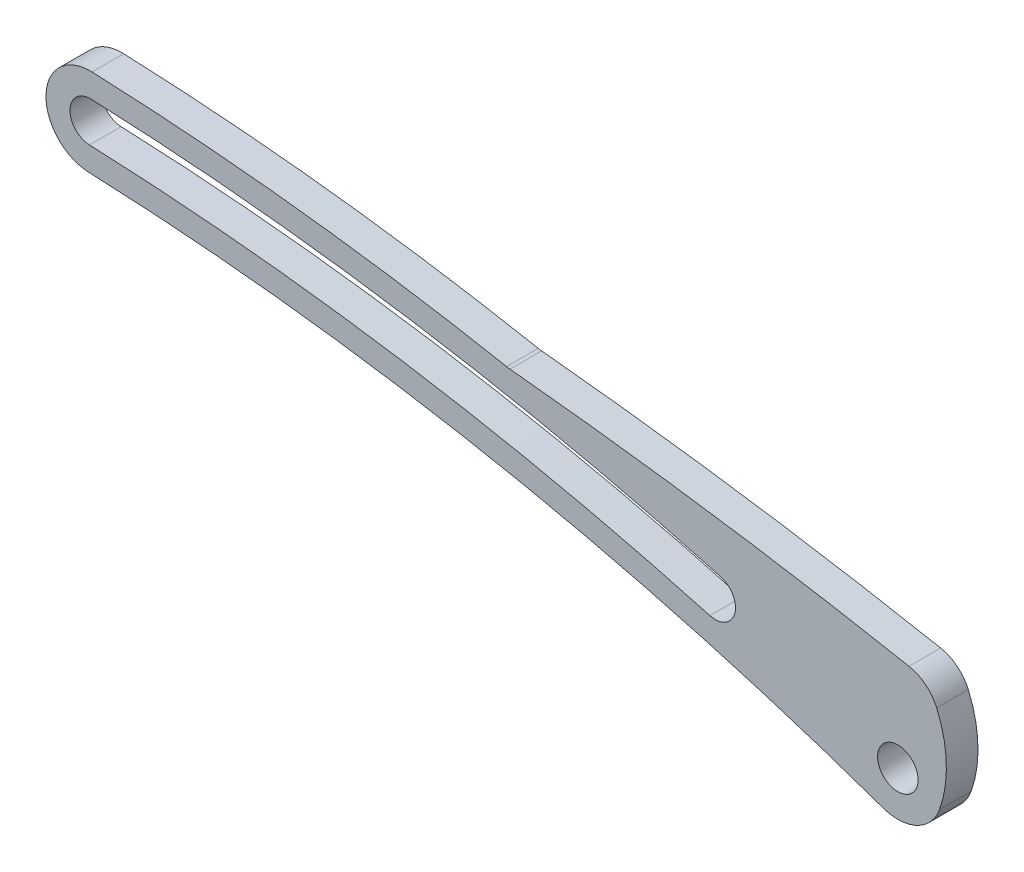
from build123d import *

# Parameters (mm, degrees)
BOSS_EXTRUDE1_DEPTH = 2.5
BOSS_EXTRUDE2_DEPTH = 2.5
FILLET1_R           = 3


with BuildPart() as part:
    # Sketch1 → Boss-Extrude1 (new body)
    with BuildSketch(Plane.XY):
        with BuildLine():
            ThreePointArc((-36.498211921, -0.894837407), (-30.682272217, -2.600735992), (-24.91598031, -4.467584206))
            ThreePointArc((-24.91598031, -4.467584206), (-23.230561506, -3.577090815), (-21.328447916, -3.701906342))
            ThreePointArc((-21.328447916, -3.701906342), (-53.283170108, 5.003711479), (-86.182644365, 8.813783084))
            ThreePointArc((-86.182644365, 8.813783084), (-89.819650793, 5.456375715), (-86.462243424, 1.819369287))
            ThreePointArc((-86.462243424, 1.819369287), (-54.60957062, -1.869472767), (-23.671589589, -10.298093658))
            ThreePointArc((-23.671589589, -10.298093658), (-25.210339365, -9.214534302), (-25.965452096, -7.490684972))
            ThreePointArc((-25.965452096, -7.490684972), (-31.636424249, -5.655196046), (-37.356120498, -3.977692071))
            ThreePointArc((-37.356120498, -3.977692071), (-61.648333057, 1.290252949), (-86.386352251, 3.717853032))
            ThreePointArc((-86.386352251, 3.717853032), (-87.921167048, 5.380484542), (-86.258535538, 6.915299339))
            ThreePointArc((-86.258535538, 6.915299339), (-61.152151238, 4.451550721), (-36.498211921, -0.894837407))
        make_face()
        with BuildLine():
            ThreePointArc((-21.964443513, -5.492300042), (-21.192937962, -6.077210854), (-20.900018752, -7))
            ThreePointArc((-20.900018752, -7), (-21.577229606, -8.30708079), (-23.035593992, -8.507699958))
            ThreePointArc((-23.035593992, -8.507699958), (-24.498688375, -7.993907076), (-25.965452096, -7.490684972))
            ThreePointArc((-25.965452096, -7.490684972), (-25.210339365, -9.214534302), (-23.671589589, -10.298093658))
            ThreePointArc((-23.671589589, -10.298093658), (-20.481417495, -9.859239228), (-19.000018752, -7))
            ThreePointArc((-19.000018752, -7), (-19.640779524, -4.981398743), (-21.328447916, -3.701906342))
            ThreePointArc((-21.328447916, -3.701906342), (-23.230561506, -3.577090815), (-24.91598031, -4.467584206))
            ThreePointArc((-24.91598031, -4.467584206), (-23.438376962, -4.974656833), (-21.964443513, -5.492300042))
        make_face()
        with BuildLine():
            ThreePointArc((-23.035593992, -8.507699958), (-24.00771871, -6.46442476), (-21.964443513, -5.492300042))
            ThreePointArc((-21.964443513, -5.492300042), (-23.438376962, -4.974656833), (-24.91598031, -4.467584206))
            ThreePointArc((-24.91598031, -4.467584206), (-25.806449767, -5.852169897), (-25.965452096, -7.490684972))
            ThreePointArc((-25.965452096, -7.490684972), (-24.498688375, -7.993907076), (-23.035593992, -8.507699958))
        make_face()
        with BuildLine():
            ThreePointArc((-25.965452096, -7.490684972), (-25.806449767, -5.852169897), (-24.91598031, -4.467584206))
            ThreePointArc((-24.91598031, -4.467584206), (-30.682272217, -2.600735992), (-36.498211921, -0.894837407))
            ThreePointArc((-36.498211921, -0.894837407), (-35.385738878, -2.865219027), (-37.356120498, -3.977692071))
            ThreePointArc((-37.356120498, -3.977692071), (-31.636424249, -5.655196046), (-25.965452096, -7.490684972))
        make_face()
    extrude(amount=BOSS_EXTRUDE1_DEPTH)

    # Sketch2 → Boss-Extrude2 (add)
    with BuildSketch(Plane(origin=(0, 0, 0), x_dir=(-1, 0, 0), z_dir=(0, 0, -1))):
        with BuildLine():
            ThreePointArc((53.283170108, 5.003711479), (36.704107241, 2.974392367), (20.240739247, 0.156418643))
            ThreePointArc((20.240739247, 0.156418643), (18.734449346, -3.884474615), (19.201925094, -8.171570836))
            ThreePointArc((19.201925094, -8.171570836), (19.339488679, -5.496321293), (21.328447916, -3.701906342))
            ThreePointArc((21.328447916, -3.701906342), (37.141755573, 1.253074886), (53.283170108, 5.003711479))
        make_face()
    extrude(amount=-BOSS_EXTRUDE2_DEPTH)

    # Fillet1
    # the kernel refuses this fillet: 3 mm, written as the material it adds along each edge
    with BuildSketch(Plane(origin=(-53.283170108, 5.003711479, 0), x_dir=(-0.9819426110261866, 0.1891790386144179, 0), z_dir=(0, 0, 1))) as fillet1_piece_1:
        with BuildLine():
            CenterArc((0.138392848, -2.999999854), FILLET1_R, 90.017899156, 5.253257813)
            ThreePointArc((-0.137215119, -0.012686638), (-0.068606935, -0.006350072), (0, 0))
            ThreePointArc((0, 0), (0.068727825, -1.0735e-05), (0.13745565, 0))
        make_face()
    extrude(amount=2.5)
    # the kernel refuses this fillet: 3 mm, written as the material it takes off along each edge
    with BuildSketch(Plane(origin=(-20.240739247, 0.156418643, -4.239797149), x_dir=(0.4782853989003676, -0.8782044620694638, 0), z_dir=(0, 0, 1))) as fillet1_2_piece_1:
        with BuildLine():
            CenterArc((1.423846315, -2.987637282), FILLET1_R, 84.796647689, 55.779400765)
            ThreePointArc((-0.893558187, -1.082476824), (-0.447321739, -0.540790471), (0, 0))
            ThreePointArc((0, 0), (0.84795943, 0.03853047), (1.69591886, 0))
        make_face()
    extrude(amount=10.979594298, mode=Mode.SUBTRACT)


solid = part.part
